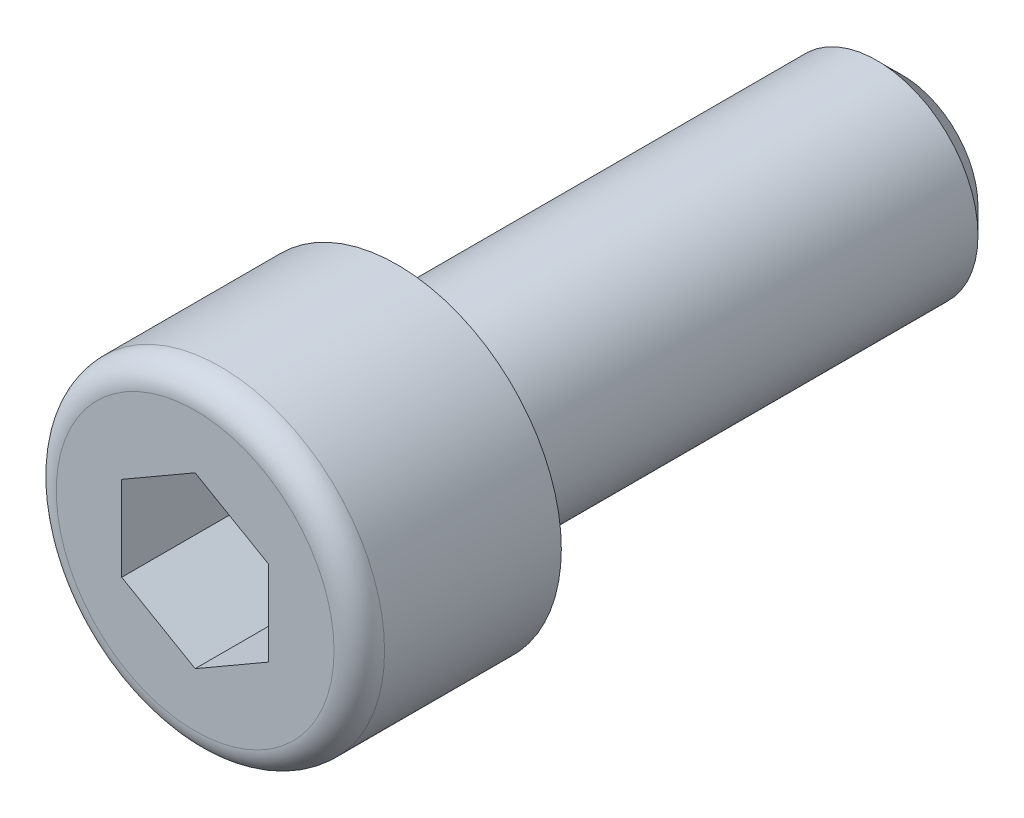
from build123d import *

# Parameters (mm, degrees)
ESQUISSE1_R             = 4
BOSS_EXTRU_1_DEPTH      = 20
ESQUISSE2_R             = 6.5
BOSS_EXTRU_2_DEPTH      = 8
CONG_1_R                = 1
CHANFREIN1_SIZE         = 1
ENL_V_MAT_EXTRU_1_DEPTH = 5


with BuildPart() as part:
    # Esquisse1 → Boss.-Extru.1 (new body)
    with BuildSketch(Plane.XY):
        with Locations((-326.297546771, 10)):
            Circle(ESQUISSE1_R)
    extrude(amount=-BOSS_EXTRU_1_DEPTH)

    # Esquisse2 → Boss.-Extru.2 (add)
    with BuildSketch(Plane.XY):
        with Locations((-326.297546771, 10)):
            Circle(ESQUISSE2_R)
    extrude(amount=BOSS_EXTRU_2_DEPTH)

    # Congé1
    cong_1_edges = [part.edges().sort_by_distance(p)[0] for p in [
        (-332.797546771, 10, 8),
    ]]
    fillet(cong_1_edges, radius=CONG_1_R)

    # Chanfrein1
    chanfrein1_edges = [part.edges().sort_by_distance(p)[0] for p in [
        (-330.297546771, 10, -20),
    ]]
    chamfer(chanfrein1_edges, length=CHANFREIN1_SIZE)

    # Esquisse3 → Enlèv. mat.-Extru.1 (cut)
    with BuildSketch(Plane.XY.offset(8)):
        Polygon((-326.297546771, 13.358158884), (-329.205797674, 11.679079442), (-329.205797674, 8.320920558), (-326.297546771, 6.641841116), (-323.389295868, 8.320920558), (-323.389295868, 11.679079442), align=None)
    extrude(amount=-ENL_V_MAT_EXTRU_1_DEPTH, mode=Mode.SUBTRACT)


solid = part.part
